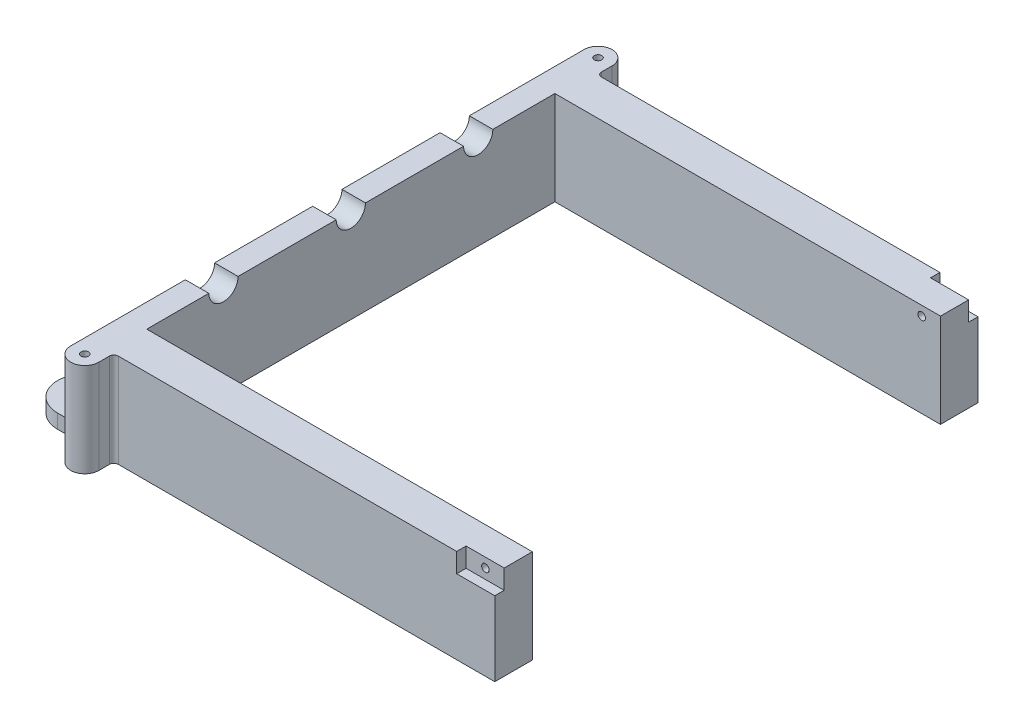
from build123d import *

# Parameters (mm, degrees)
SKETCH1_W               = 276.86
SKETCH1_H               = 163.5252
SKETCH1_W_2             = 260.9596
SKETCH1_H_2             = 138.1252
BOSS_EXTRUDE1_DEPTH     = 31.75
SKETCH2_R               = 4.953
CUT_EXTRUDE1_DEPTH      = 291.421495173
SKETCH3_R               = 1.27
BOSS_EXTRUDE2_DEPTH     = 31.75
MIRROR4_COPY_1_SKETCH_R = 1.27
MIRROR4_COPY_1_DEPTH    = 31.75
FILLET2_R               = 1.524
SKETCH4_W               = 25.781
SKETCH4_H               = 13.081
CUT_EXTRUDE2_DEPTH      = 3.175
CUT_EXTRUDE3_REACH      = 223.668
SKETCH5_R               = 1.27
CUT_EXTRUDE4_DEPTH      = 170.004206297
SKETCH7_R               = 3.556
BOSS_EXTRUDE3_DEPTH     = 4.7752
FILLET3_R               = 9.525


with BuildPart() as part:
    # Sketch1 → Boss-Extrude1 (new body)
    with BuildSketch(Plane(origin=(0, 0, 0), x_dir=(1, 0, 0), z_dir=(0, 1, 0))):
        Rectangle(SKETCH1_W, SKETCH1_H)
        Rectangle(SKETCH1_W_2, SKETCH1_H_2, mode=Mode.SUBTRACT)
    extrude(amount=BOSS_EXTRUDE1_DEPTH)

    # Sketch2 → Cut-Extrude1 (cut, through all)
    with BuildSketch(Plane(origin=(138.43, 0, 0), x_dir=(0, 0, -1), z_dir=(1, 0, 0))):
        with Locations((0, 31.75)):
            Circle(SKETCH2_R)
        with Locations((43.1038, 31.75)):
            Circle(SKETCH2_R)
        with Locations((-43.1038, 31.75)):
            Circle(SKETCH2_R)
    extrude(amount=-CUT_EXTRUDE1_DEPTH, mode=Mode.SUBTRACT)

    # Sketch3 → Boss-Extrude2 (add, through all)
    with BuildSketch(Plane(origin=(0, 31.75, 0), x_dir=(1, 0, 0), z_dir=(0, 1, 0))):
        with BuildLine():
            Line((-138.43, 81.7626), (-138.43, 86.8426))
            ThreePointArc((-138.43, 86.8426), (-133.6675, 91.6051), (-128.905, 86.8426))
            Line((-128.905, 86.8426), (-128.905, 81.7626))
            Line((-128.905, 81.7626), (-138.43, 81.7626))
        make_face()
        with Locations(Location((-133.6675, 86.8426, 0), (0, 0, 270))):
            Circle(SKETCH3_R, mode=Mode.SUBTRACT)
    boss_extrude2 = extrude(amount=-BOSS_EXTRUDE2_DEPTH)

    # Mirror3: Boss-Extrude2 across plane
    add(boss_extrude2.mirror(Plane(origin=(0, 0, 0), x_dir=(0, 0, 1), z_dir=(1, 0, 0))))

    # Mirror4: Boss-Extrude2 across plane
    add(boss_extrude2.mirror(Plane.XY))

    # Mirror4 copy 1 sketch → Mirror4 copy 1 (add, through all)
    with BuildSketch(Plane(origin=(0, 31.75, 0), x_dir=(-1, 0, 0), z_dir=(0, 1, 0))):
        with BuildLine():
            Line((-138.43, 81.7626), (-138.43, 86.8426))
            ThreePointArc((-138.43, 86.8426), (-133.6675, 91.6051), (-128.905, 86.8426))
            Line((-128.905, 86.8426), (-128.905, 81.7626))
            Line((-128.905, 81.7626), (-138.43, 81.7626))
        make_face()
        with Locations(Location((-133.6675, 86.8426, 0), (0, 0, 270))):
            Circle(MIRROR4_COPY_1_SKETCH_R, mode=Mode.SUBTRACT)
    extrude(amount=-MIRROR4_COPY_1_DEPTH)

    # Fillet2
    fillet2_edges = [part.edges().sort_by_distance(p)[0] for p in [
        (-128.905, 15.875, 81.7626),
        (128.905, 15.875, 81.7626),
        (-128.905, 15.875, -81.7626),
        (128.905, 15.875, -81.7626),
    ]]
    fillet(fillet2_edges, radius=FILLET2_R)

    # Sketch4 → Cut-Extrude2 (cut)
    with BuildSketch(Plane(origin=(0, 0, -81.7626), x_dir=(-1, 0, 0), z_dir=(0, 0, -1))):
        with Locations((0, 31.75)):
            Rectangle(SKETCH4_W, SKETCH4_H)
    cut_extrude2 = extrude(amount=-CUT_EXTRUDE2_DEPTH, mode=Mode.SUBTRACT)

    # Sketch5 → Cut-Extrude3 (cut, up to next)
    with BuildSketch(Plane(origin=(0, 0, -78.5876), x_dir=(-1, 0, 0), z_dir=(0, 0, -1)), mode=Mode.PRIVATE) as cut_extrude3_sk1:
        with Locations((-6.35, 28.575)):
            Circle(SKETCH5_R)
    cut_extrude3_tool1 = extrude(cut_extrude3_sk1.sketch, amount=-CUT_EXTRUDE3_REACH, mode=Mode.PRIVATE) & part.part
    # Sketch5 → Cut-Extrude3 (cut, up to next)
    with BuildSketch(Plane(origin=(0, 0, -78.5876), x_dir=(-1, 0, 0), z_dir=(0, 0, -1)), mode=Mode.PRIVATE) as cut_extrude3_sk2:
        with Locations((6.35, 28.575)):
            Circle(SKETCH5_R)
    cut_extrude3_tool2 = extrude(cut_extrude3_sk2.sketch, amount=-CUT_EXTRUDE3_REACH, mode=Mode.PRIVATE) & part.part
    cut_extrude3_1 = cut_extrude3_tool1.solids().sort_by_distance((6.35, 28.575, -78.5876))[0]
    add(cut_extrude3_1, mode=Mode.SUBTRACT)
    cut_extrude3_2 = cut_extrude3_tool2.solids().sort_by_distance((-6.35, 28.575, -78.5876))[0]
    add(cut_extrude3_2, mode=Mode.SUBTRACT)
    cut_extrude3 = cut_extrude3_1 + cut_extrude3_2  # Cut-Extrude3 as one shape, for the pattern or mirror that repeats it

    # Mirror5: Cut-Extrude2, Cut-Extrude3 across plane
    add(cut_extrude2.mirror(Plane.XY), mode=Mode.SUBTRACT)
    add(cut_extrude3.mirror(Plane.XY), mode=Mode.SUBTRACT)

    # Sketch6 → Cut-Extrude4 (cut, through all)
    with BuildSketch(Plane(origin=(0, 31.75, 0), x_dir=(1, 0, 0), z_dir=(0, 1, 0))):
        Polygon((0, 0), (0, 94.782822777), (154.500251477, 94.782822777), (154.500251477, -104.416951251), (0, -98.891495214), align=None)
    extrude(amount=-CUT_EXTRUDE4_DEPTH, mode=Mode.SUBTRACT)

    # Sketch7 → Boss-Extrude3 (add)
    with BuildSketch(Plane.XZ):
        with BuildLine():
            Line((-138.43, 81.7626), (-147.955, 81.7626))
            ThreePointArc((-147.955, 81.7626), (-157.48, 72.2376), (-147.955, 62.7126))
            Line((-147.955, 62.7126), (-138.43, 62.7126))
            Line((-138.43, 62.7126), (-138.43, 81.7626))
        make_face()
        with Locations(Location((-147.955, 72.2376, 0), (0, 0, 270))):
            Circle(SKETCH7_R, mode=Mode.SUBTRACT)
    boss_extrude3 = extrude(amount=-BOSS_EXTRUDE3_DEPTH)

    # Mirror6: Boss-Extrude3 across plane
    add(boss_extrude3.mirror(Plane.XY))

    # Fillet3
    fillet3_edges = [part.edges().sort_by_distance(p)[0] for p in [
        (-138.43, 2.3876, -62.7126),
        (-138.43, 2.3876, 62.7126),
    ]]
    fillet(fillet3_edges, radius=FILLET3_R - 0.0001)  # a hair under: the kernel refuses the full size


solid = part.part
